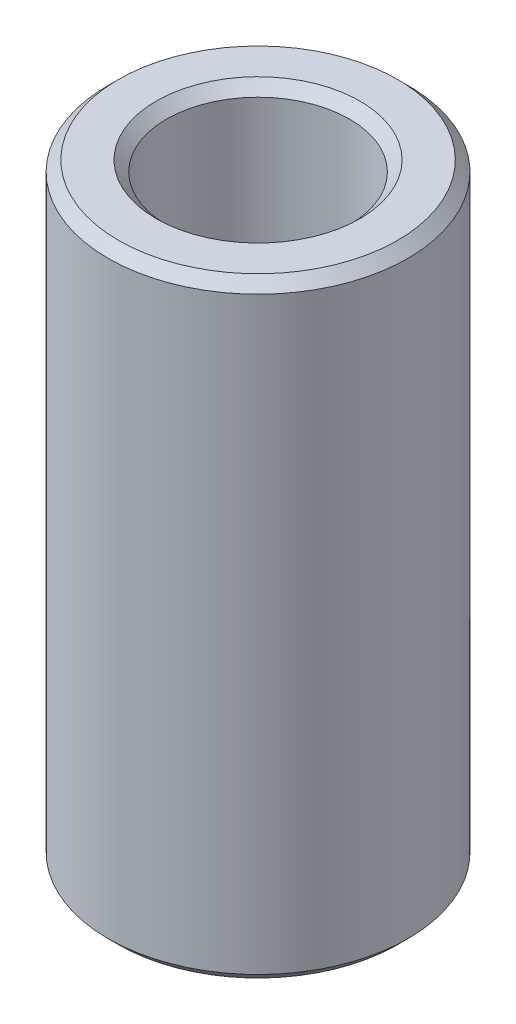
from build123d import *

# Parameters (mm, degrees)
SKETCH1_R           = 7.5
BOSS_EXTRUDE1_DEPTH = 30.523211752
SKETCH2_R           = 4.578092323
CUT_EXTRUDE1_DEPTH  = 33.313564577
CHAMFER1_SIZE       = 0.519848847


with BuildPart() as part:
    # Sketch1 → Boss-Extrude1 (new body)
    with BuildSketch(Plane(origin=(0, 0, 0), x_dir=(1, 0, 0), z_dir=(0, 1, 0))):
        Circle(SKETCH1_R)
    extrude(amount=BOSS_EXTRUDE1_DEPTH)

    # Sketch2 → Cut-Extrude1 (cut, through all)
    with BuildSketch(Plane(origin=(0, 0, 0), x_dir=(1, 0, 0), z_dir=(0, 1, 0))):
        Circle(SKETCH2_R)
    extrude(amount=CUT_EXTRUDE1_DEPTH, mode=Mode.SUBTRACT)

    # Chamfer1
    chamfer1_edges = [part.edges().sort_by_distance(p)[0] for p in [
        (-4.578092323, 30.523211752, 0),
        (-4.578092323, 0, 0),
        (-7.5, 0, 0),
        (-7.5, 30.523211752, 0),
    ]]
    chamfer(chamfer1_edges, length=CHAMFER1_SIZE)


solid = part.part
